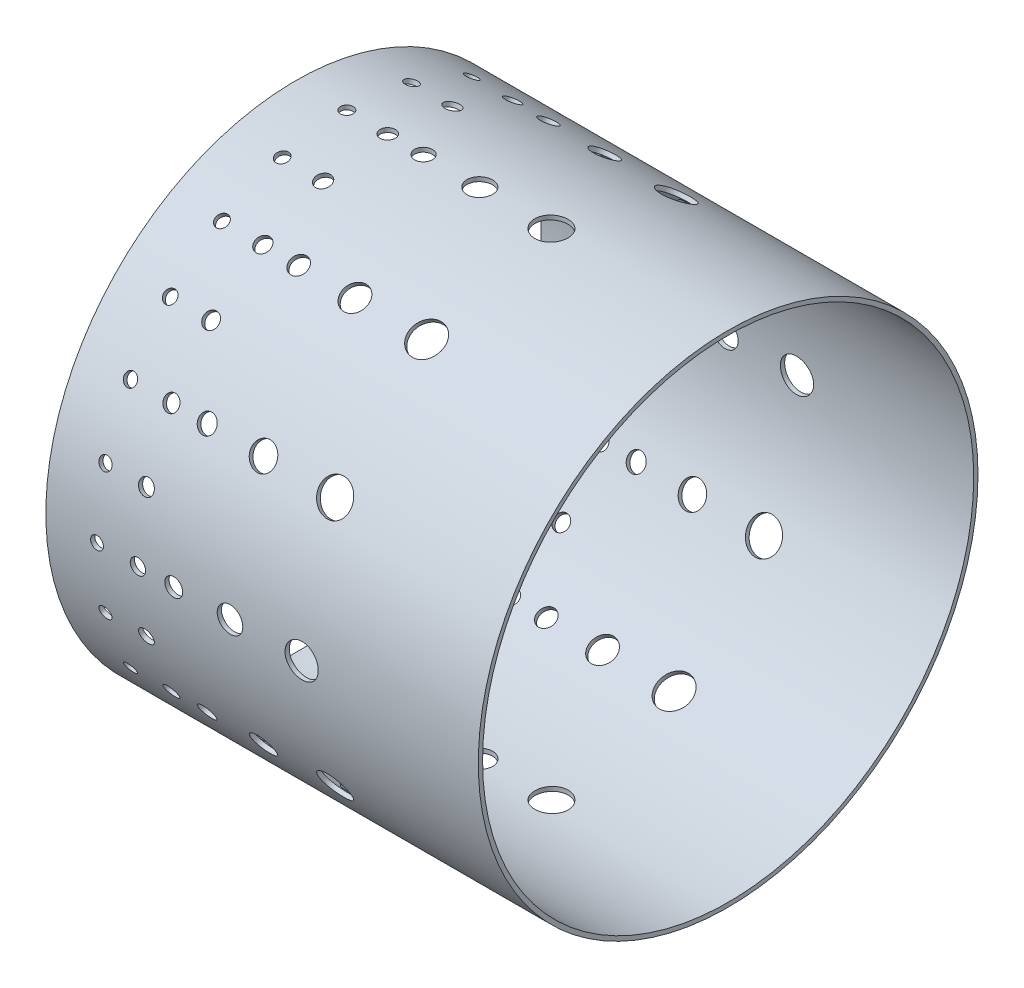
from build123d import *

# Parameters (mm, degrees)
SKETCH1_R           = 48.8442
SKETCH1_R_2         = 48.006
BOSS_EXTRUDE1_DEPTH = 84.5439
SKETCH2_R           = 1.25
CUT_EXTRUDE1_DEPTH  = 110.175009844
CIRPATTERN1_COUNT   = 24
SKETCH4_R           = 1.5
CUT_EXTRUDE2_DEPTH  = 110.175010013
CIRPATTERN2_COUNT   = 24
SKETCH5_R           = 1.75
CUT_EXTRUDE3_DEPTH  = 110.175010015
CIRPATTERN3_COUNT   = 12
SKETCH6_R           = 2.5
CUT_EXTRUDE4_DEPTH  = 110.17501002
CIRPATTERN4_COUNT   = 12
SKETCH7_R           = 3.25
CUT_EXTRUDE5_DEPTH  = 110.17501002
CIRPATTERN5_COUNT   = 12


with BuildPart() as part:
    # Sketch1 → Boss-Extrude1 (new body)
    with BuildSketch(Plane(origin=(0, 0, 0), x_dir=(0, 0, -1), z_dir=(1, 0, 0))):
        Circle(SKETCH1_R)
        Circle(SKETCH1_R_2, mode=Mode.SUBTRACT)
    extrude(amount=BOSS_EXTRUDE1_DEPTH)

    # Sketch2 → Cut-Extrude1 (cut, through all)
    with BuildSketch(Plane(origin=(0, 0, 0), x_dir=(1, 0, 0), z_dir=(0, 1, 0))):
        with Locations((10, 0)):
            Circle(SKETCH2_R)
    cut_extrude1 = extrude(amount=-CUT_EXTRUDE1_DEPTH, mode=Mode.SUBTRACT)

    # CirPattern1: Cut-Extrude1 ×24 about axis
    cirpattern1_axis = Axis((0, 0, 0), (1, 0, 0))
    for i in range(1, CIRPATTERN1_COUNT):
        add(cut_extrude1.rotate(cirpattern1_axis, i * 360 / CIRPATTERN1_COUNT), mode=Mode.SUBTRACT)

    # Sketch4 → Cut-Extrude2 (cut, through all)
    with BuildSketch(Plane.XY):
        with Locations((18, 0)):
            Circle(SKETCH4_R)
    cut_extrude2 = extrude(amount=-CUT_EXTRUDE2_DEPTH, mode=Mode.SUBTRACT)

    # CirPattern2: Cut-Extrude2 ×24 about axis
    cirpattern2_axis = Axis((0, 0, 0), (1, 0, 0))
    for i in range(1, CIRPATTERN2_COUNT):
        add(cut_extrude2.rotate(cirpattern2_axis, i * 360 / CIRPATTERN2_COUNT), mode=Mode.SUBTRACT)

    # Sketch5 → Cut-Extrude3 (cut, through all)
    with BuildSketch(Plane.XY):
        with Locations((25, 0)):
            Circle(SKETCH5_R)
    cut_extrude3 = extrude(amount=-CUT_EXTRUDE3_DEPTH, mode=Mode.SUBTRACT)

    # CirPattern3: Cut-Extrude3 ×12 about axis
    cirpattern3_axis = Axis((0, 0, 0), (1, 0, 0))
    for i in range(1, CIRPATTERN3_COUNT):
        add(cut_extrude3.rotate(cirpattern3_axis, i * 360 / CIRPATTERN3_COUNT), mode=Mode.SUBTRACT)

    # Sketch6 → Cut-Extrude4 (cut, through all)
    with BuildSketch(Plane.XY):
        with Locations((36, 0)):
            Circle(SKETCH6_R)
    cut_extrude4 = extrude(amount=-CUT_EXTRUDE4_DEPTH, mode=Mode.SUBTRACT)

    # CirPattern4: Cut-Extrude4 ×12 about axis
    cirpattern4_axis = Axis((0, 0, 0), (1, 0, 0))
    for i in range(1, CIRPATTERN4_COUNT):
        add(cut_extrude4.rotate(cirpattern4_axis, i * 360 / CIRPATTERN4_COUNT), mode=Mode.SUBTRACT)

    # Sketch7 → Cut-Extrude5 (cut, through all)
    with BuildSketch(Plane(origin=(0, 0, 0), x_dir=(1, 0, 0), z_dir=(0, 1, 0))):
        with Locations((50, 0)):
            Circle(SKETCH7_R)
    cut_extrude5 = extrude(amount=-CUT_EXTRUDE5_DEPTH, mode=Mode.SUBTRACT)

    # CirPattern5: Cut-Extrude5 ×12 about axis
    cirpattern5_axis = Axis((84.5439, 0, 0), (-1, 0, 0))
    for i in range(1, CIRPATTERN5_COUNT):
        add(cut_extrude5.rotate(cirpattern5_axis, i * 360 / CIRPATTERN5_COUNT), mode=Mode.SUBTRACT)


solid = part.part
